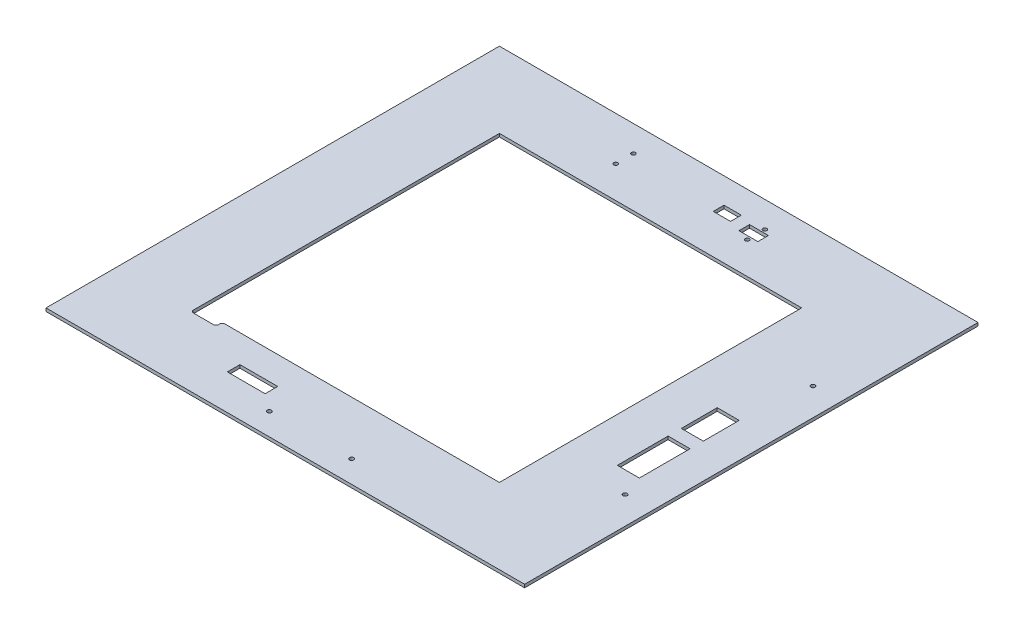
from build123d import *

# Parameters (mm, degrees)
SKETCH1_W           = 482.6
SKETCH1_H           = 457.2
SKETCH1_W_2         = 38.1
SKETCH1_H_2         = 12.7
SKETCH1_R           = 2.1
SKETCH1_R_2         = 2.0955
SKETCH1_W_3         = 22.197164078
SKETCH1_H_3         = 51.155633978
SKETCH1_R_3         = 2
SKETCH1_H_4         = 36.225516101
SKETCH1_W_4         = 17.438820998
SKETCH1_H_5         = 10.883645004
SKETCH1_W_5         = 19.05
SKETCH1_H_6         = 10.668
BOSS_EXTRUDE1_DEPTH = 3.175
FILLET1_R           = 2.54


with BuildPart() as part:
    # Sketch1 → Boss-Extrude1 (new body)
    with BuildSketch(Plane(origin=(0, 0, 0), x_dir=(1, 0, 0), z_dir=(0, 1, 0))):
        with Locations((-1.251503591, 0)):
            Rectangle(SKETCH1_W, SKETCH1_H)
        with Locations((-76.181503591, -186.695610311)):
            Rectangle(SKETCH1_W_2, SKETCH1_H_2, mode=Mode.SUBTRACT)
        with Locations((-39.643603591, -206.2861)):
            Circle(SKETCH1_R, mode=Mode.SUBTRACT)
        Polygon((-166.351503591, -152.4), (-166.351503591, 152.4), (138.448496409, 152.4), (138.448496409, -152.4), (-140.951503591, -152.4), (-140.951503591, -158.75), (-166.351503591, -158.75), align=None, mode=Mode.SUBTRACT)
        with Locations((43.338196409, -206.2861)):
            Circle(SKETCH1_R, mode=Mode.SUBTRACT)
        with Locations((212.390436409, -99.579800078)):
            Circle(SKETCH1_R_2, mode=Mode.SUBTRACT)
        with Locations((194.083935921, -52.428980659)):
            Rectangle(SKETCH1_W_3, SKETCH1_H_3, mode=Mode.SUBTRACT)
        with Locations((-81.109103591, 184.531)):
            Circle(SKETCH1_R_3, mode=Mode.SUBTRACT)
        with Locations((-81.109103591, 202.311)):
            Circle(SKETCH1_R_3, mode=Mode.SUBTRACT)
        with Locations((194.083935921, 4.575109653)):
            Rectangle(SKETCH1_W_3, SKETCH1_H_4, mode=Mode.SUBTRACT)
        with Locations((212.390436409, 89.827999922)):
            Circle(SKETCH1_R_2, mode=Mode.SUBTRACT)
        with Locations((18.318465636, 197.512214728)):
            Rectangle(SKETCH1_W_4, SKETCH1_H_5, mode=Mode.SUBTRACT)
        with Locations((51.351896409, 184.531)):
            Circle(SKETCH1_R_3, mode=Mode.SUBTRACT)
        with Locations((48.913496409, 193.548)):
            Rectangle(SKETCH1_W_5, SKETCH1_H_6, mode=Mode.SUBTRACT)
        with Locations((51.351896409, 202.311)):
            Circle(SKETCH1_R_3, mode=Mode.SUBTRACT)
    extrude(amount=BOSS_EXTRUDE1_DEPTH)

    # Fillet1
    fillet1_edges = [part.edges().sort_by_distance(p)[0] for p in [
        (-140.951503591, 1.5875, 158.75),
        (-166.351503591, 1.5875, 158.75),
        (-140.951503591, 1.5875, 152.4),
    ]]
    fillet(fillet1_edges, radius=FILLET1_R)


solid = part.part
